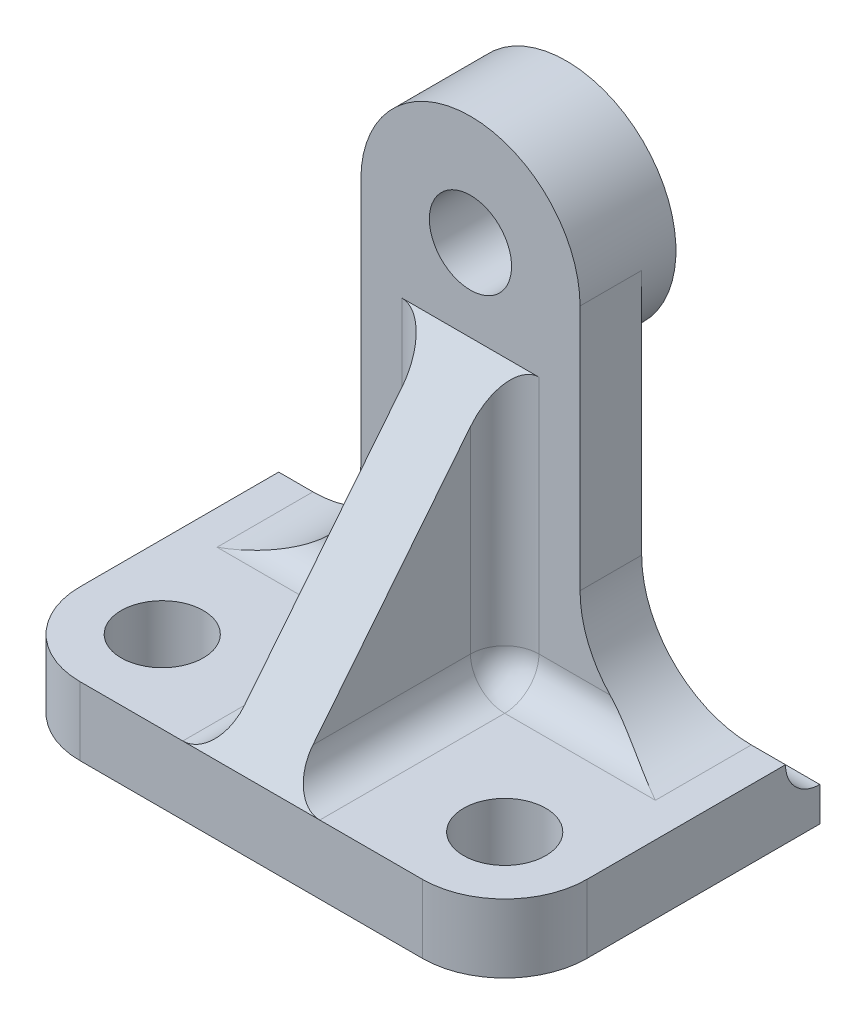
from build123d import *

# Parameters (mm, degrees)
SKETCH8_W               = 74
SKETCH8_H               = 10
BOSS_EXTRUDE9_DEPTH     = 46
FILLET8_R               = 12
FILLET9_R               = 12
CUT_EXTRUDE3_DEPTH      = 88.704047797
CUT_EXTRUDE3_DEPTH_BACK = 88.704047797
SKETCH13_R              = 6
BOSS_EXTRUDE10_DEPTH    = 14
CUT_EXTRUDE4_REACH      = 99.719
SKETCH15_W              = 5
SKETCH15_H              = 52
SKETCH26_R              = 16
BOSS_EXTRUDE11_DEPTH    = 14
FILLET11_R              = 5
FILLET12_START          = 5
FILLET12_DEPTH          = 14
FILLET12_START_2        = -27.782193151
FILLET12_2_DEPTH        = 64.0000001
SKETCH28_R              = 6
CUT_EXTRUDE5_DEPTH      = 92.863527091
RIB2_REACH              = 92.05
SKETCH31_WALL_W         = 233.324966138
SKETCH31_WALL_H         = 10
FILLET13_R              = 5
SKETCH36_R              = 6
CUT_EXTRUDE6_DEPTH      = 92.863527091


with BuildPart() as part:
    # Sketch8 → Boss-Extrude9 (new body)
    with BuildSketch(Plane.XY):
        with Locations((4.217806949, -5)):
            Rectangle(SKETCH8_W, SKETCH8_H)
    extrude(amount=BOSS_EXTRUDE9_DEPTH)

    # Fillet8
    fillet8_edges = [part.edges().sort_by_distance(p)[0] for p in [
        (-32.782193051, -5, 46),
    ]]
    fillet(fillet8_edges, radius=FILLET8_R)

    # Fillet9
    fillet9_edges = [part.edges().sort_by_distance(p)[0] for p in [
        (41.217806949, -5, 46),
    ]]
    fillet(fillet9_edges, radius=FILLET9_R)

    # Sketch10 → Cut-Extrude3 (cut, two sides: drawn at the far end of the back side and taken through both)
    with BuildSketch(Plane.ZY.offset(32.782193051).offset(-CUT_EXTRUDE3_DEPTH_BACK)):
        with BuildLine():
            Line((5, 102.54188241), (5, 0))
            ThreePointArc((5, 0), (3.535533906, -3.535533906), (0, -5))
            Line((0, -5), (-102.54188241, -5))
            Line((-102.54188241, -5), (-247.558003226, 140.016120816))
            Line((-247.558003226, 140.016120816), (-140.016120816, 247.558003226))
            Line((-140.016120816, 247.558003226), (5, 102.54188241))
        make_face()
    extrude(amount=CUT_EXTRUDE3_DEPTH + CUT_EXTRUDE3_DEPTH_BACK, mode=Mode.SUBTRACT)

    # Sketch13 → Boss-Extrude10 (add)
    with BuildSketch(Plane.XY):
        with BuildLine():
            Line((-11.782193051, 0), (20.217806949, 0))
            Line((20.217806949, 0), (20.217806949, 52))
            ThreePointArc((20.217806949, 52), (4.217806949, 68), (-11.782193051, 52))
            Line((-11.782193051, 52), (-11.782193051, 0))
        make_face()
        with Locations((4.217806949, 52)):
            Circle(SKETCH13_R, mode=Mode.SUBTRACT)
    extrude(amount=BOSS_EXTRUDE10_DEPTH)

    # Sketch15 → Cut-Extrude4 (cut, up to next)
    with BuildSketch(Plane.ZY.offset(11.782193051), mode=Mode.PRIVATE) as cut_extrude4_sk1:
        with Locations((2.5, 26)):
            Rectangle(SKETCH15_W, SKETCH15_H)
    cut_extrude4_tool1 = extrude(cut_extrude4_sk1.sketch, amount=-CUT_EXTRUDE4_REACH, mode=Mode.PRIVATE) & part.part
    add(cut_extrude4_tool1.solids().sort_by_distance((-11.782193, 26, 2.5))[0], mode=Mode.SUBTRACT)

    # Sketch26 → Boss-Extrude11 (add)
    with BuildSketch(Plane(origin=(0, 0, 0), x_dir=(-1, 0, 0), z_dir=(0, 0, -1))):
        with Locations((-4.217806949, 52)):
            Circle(SKETCH26_R)
    extrude(amount=-BOSS_EXTRUDE11_DEPTH)

    # Fillet11
    fillet11_edges = [part.edges().sort_by_distance(p)[0] for p in [
        (4.217806949, 0, 14),
    ]]
    fillet(fillet11_edges, radius=FILLET11_R)

    # Fillet12: read off the stored shape, not the designer's step
    # Fillet12 outline → Fillet12 (add)
    with BuildSketch(Plane.XY.offset(FILLET12_START)):
        with BuildLine():
            Line((-11.782193051, 0), (-11.782193051, 16))
            ThreePointArc((-11.782193051, 16), (-16.468484552, 4.686291501), (-27.782193051, 0))
            Line((-27.782193051, 0), (-11.782193051, 0))
        make_face()
        with BuildLine():
            Line((20.217806949, 16), (20.217806949, 0))
            Line((20.217806949, 0), (36.217806949, 0))
            ThreePointArc((36.217806949, 0), (24.90409845, 4.686291501), (20.217806949, 16))
        make_face()
    extrude(amount=FILLET12_DEPTH)

    # Fillet12 2 outline → Fillet12 2 (cut)
    with BuildSketch(Plane.YZ.offset(FILLET12_START_2)):
        with BuildLine():
            Line((16, 19), (0, 19))
            ThreePointArc((0, 19), (1.464466094, 15.464466094), (5, 14))
            Line((5, 14), (16, 14))
            Line((16, 14), (16, 19))
        make_face()
    extrude(amount=FILLET12_2_DEPTH, mode=Mode.SUBTRACT)

    # Sketch28 → Cut-Extrude5 (cut, through all)
    with BuildSketch(Plane(origin=(0, 0, 0), x_dir=(-1, 0, 0), z_dir=(0, 0, -1))):
        with Locations((-4.217806949, 52)):
            Circle(SKETCH28_R)
    extrude(amount=-CUT_EXTRUDE5_DEPTH, mode=Mode.SUBTRACT)

    # Sketch31 wall → Rib2 (add, up to next)
    with BuildSketch(Plane(origin=(4.217806949, 20, 30), x_dir=(0, -0.780868809443, 0.624695047554), z_dir=(0, 0.624695047554, 0.780868809443)), mode=Mode.PRIVATE) as rib2_sk1:
        Rectangle(SKETCH31_WALL_W, SKETCH31_WALL_H)
    rib2_tool1 = extrude(rib2_sk1.sketch, amount=-RIB2_REACH, mode=Mode.PRIVATE) - part.part
    add(rib2_tool1.solids().sort_by_distance((4.217806949, 20, 30))[0])

    # Fillet13
    fillet13_edges = [part.edges().sort_by_distance(p)[0] for p in [
        (-0.782193051, 0, 32.5),
        (-0.782193051, 1.464466094, 15.464466094),
        (-0.782193051, 22.5, 14),
        (9.217806949, 1.464466094, 15.464466094),
        (9.217806949, 22.5, 14),
        (9.217806949, 0, 32.5),
    ]]
    fillet(fillet13_edges, radius=FILLET13_R)

    # Sketch36 → Cut-Extrude6 (cut, through all)
    with BuildSketch(Plane(origin=(0, 0, 0), x_dir=(1, 0, 0), z_dir=(0, 1, 0))):
        with Locations(Location((-20.782193051, -34, 0), (0, 0, 270))):
            Circle(SKETCH36_R)
        with Locations(Location((29.217806949, -34, 0), (0, 0, 270))):
            Circle(SKETCH36_R)
    extrude(amount=-CUT_EXTRUDE6_DEPTH, mode=Mode.SUBTRACT)


solid = part.part
